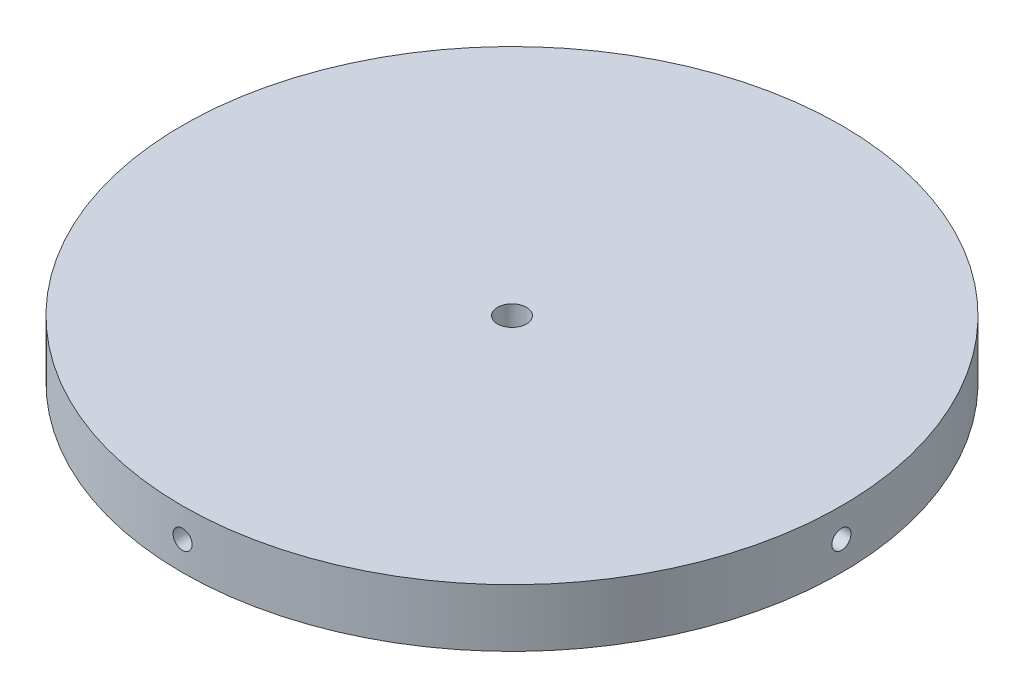
from build123d import *

# Parameters (mm, degrees)
SKETCH1_R                       = 57
BOSS_EXTRUDE1_DEPTH             = 5
M6_TAPPED_HOLE1_D               = 5
M4_TAPPED_HOLE1_D               = 3.3
M4_TAPPED_HOLE1_DEPTH           = 14.1
M4_TAPPED_HOLE1_TIP             = 0.991420021
M4_TAPPED_HOLE1_ON_FACE_2_D     = 3.3
M4_TAPPED_HOLE1_ON_FACE_2_DEPTH = 14.1
M4_TAPPED_HOLE1_ON_FACE_2_TIP   = 0.991420021
M4_TAPPED_HOLE1_ON_FACE_3_D     = 3.3
M4_TAPPED_HOLE1_ON_FACE_3_DEPTH = 14.1
M4_TAPPED_HOLE1_ON_FACE_3_TIP   = 0.991420021
M4_TAPPED_HOLE1_ON_FACE_4_D     = 3.3
M4_TAPPED_HOLE1_ON_FACE_4_DEPTH = 14.1
M4_TAPPED_HOLE1_ON_FACE_4_TIP   = 0.991420021


with BuildPart() as part:
    # Sketch1 → Boss-Extrude1 (new, symmetric)
    with BuildSketch(Plane(origin=(0, 0, 0), x_dir=(1, 0, 0), z_dir=(0, 1, 0))):
        Circle(SKETCH1_R)
    extrude(amount=BOSS_EXTRUDE1_DEPTH, both=True)

    # M6 Tapped Hole1 (through all)
    with Locations(Plane(origin=(0, 5, 0), x_dir=(1, 0, 0), z_dir=(0, 1, 0))):
        with Locations((0, 0)):
            Hole(M6_TAPPED_HOLE1_D / 2)

    # M4 Tapped Hole1
    with Locations(Plane(origin=(0, 0, -57), x_dir=(-1, 0, 0), z_dir=(0, 0, -1))):
        with Locations((0, 0)):
            Hole(M4_TAPPED_HOLE1_D / 2, depth=M4_TAPPED_HOLE1_DEPTH)
            with Locations((0, 0, -(M4_TAPPED_HOLE1_DEPTH + M4_TAPPED_HOLE1_TIP / 2))):  # 118° drill point
                Cone(0, M4_TAPPED_HOLE1_D / 2, M4_TAPPED_HOLE1_TIP, mode=Mode.SUBTRACT)

    # M4 Tapped Hole1 on face 2
    with Locations(Plane(origin=(-57, 0, 0), x_dir=(0, 0, -1), z_dir=(-1, 0, 0))):
        with Locations((0, 0)):
            Hole(M4_TAPPED_HOLE1_ON_FACE_2_D / 2, depth=M4_TAPPED_HOLE1_ON_FACE_2_DEPTH)
            with Locations((0, 0, -(M4_TAPPED_HOLE1_ON_FACE_2_DEPTH + M4_TAPPED_HOLE1_ON_FACE_2_TIP / 2))):  # 118° drill point
                Cone(0, M4_TAPPED_HOLE1_ON_FACE_2_D / 2, M4_TAPPED_HOLE1_ON_FACE_2_TIP, mode=Mode.SUBTRACT)

    # M4 Tapped Hole1 on face 3
    with Locations(Plane.XY.offset(57)):
        with Locations((0, 0)):
            Hole(M4_TAPPED_HOLE1_ON_FACE_3_D / 2, depth=M4_TAPPED_HOLE1_ON_FACE_3_DEPTH)
            with Locations((0, 0, -(M4_TAPPED_HOLE1_ON_FACE_3_DEPTH + M4_TAPPED_HOLE1_ON_FACE_3_TIP / 2))):  # 118° drill point
                Cone(0, M4_TAPPED_HOLE1_ON_FACE_3_D / 2, M4_TAPPED_HOLE1_ON_FACE_3_TIP, mode=Mode.SUBTRACT)

    # M4 Tapped Hole1 on face 4
    with Locations(Plane(origin=(57, 0, 0), x_dir=(0, 0, 1), z_dir=(1, 0, 0))):
        with Locations((0, 0)):
            Hole(M4_TAPPED_HOLE1_ON_FACE_4_D / 2, depth=M4_TAPPED_HOLE1_ON_FACE_4_DEPTH)
            with Locations((0, 0, -(M4_TAPPED_HOLE1_ON_FACE_4_DEPTH + M4_TAPPED_HOLE1_ON_FACE_4_TIP / 2))):  # 118° drill point
                Cone(0, M4_TAPPED_HOLE1_ON_FACE_4_D / 2, M4_TAPPED_HOLE1_ON_FACE_4_TIP, mode=Mode.SUBTRACT)


solid = part.part
